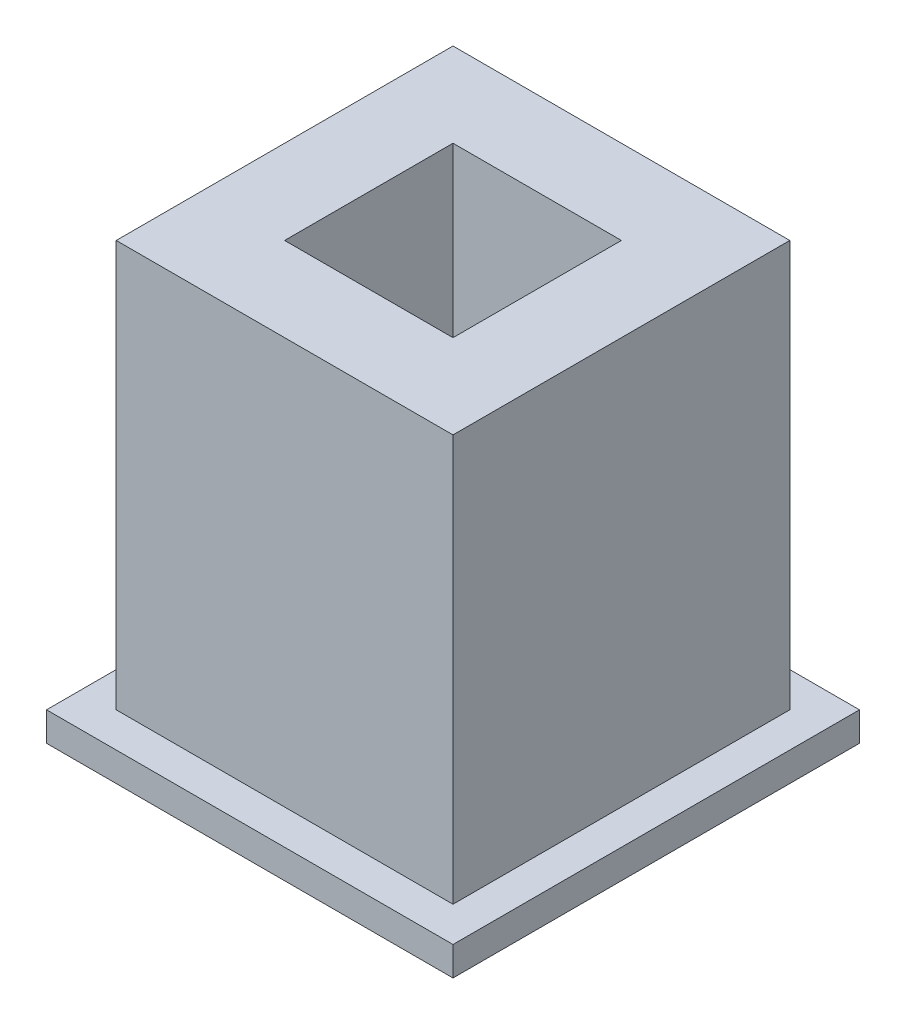
from build123d import *

# Parameters (mm, degrees)
SKETCH1_W           = 5.8
SKETCH1_H           = 5.8
BOSS_EXTRUDE1_DEPTH = 7
SKETCH3_W           = 2.9
SKETCH3_H           = 2.9
CUT_EXTRUDE1_DEPTH  = 3.8
SKETCH4_W           = 7
SKETCH4_H           = 7
BOSS_EXTRUDE2_DEPTH = 1.7
CHAMFER1_SIZE       = 1.2


with BuildPart() as part:
    # Sketch1 → Boss-Extrude1 (new body)
    with BuildSketch(Plane(origin=(0, 0, 0), x_dir=(1, 0, 0), z_dir=(0, 1, 0))):
        with Locations((2.9, 2.9)):
            Rectangle(SKETCH1_W, SKETCH1_H)
    extrude(amount=BOSS_EXTRUDE1_DEPTH)

    # Sketch3 → Cut-Extrude1 (cut)
    with BuildSketch(Plane(origin=(0, 7, 0), x_dir=(1, 0, 0), z_dir=(0, 1, 0))):
        with Locations((2.9, 2.9)):
            Rectangle(SKETCH3_W, SKETCH3_H)
    extrude(amount=-CUT_EXTRUDE1_DEPTH, mode=Mode.SUBTRACT)

    # Sketch4 → Boss-Extrude2 (add)
    with BuildSketch(Plane.XZ):
        with Locations((2.9, -2.9)):
            Rectangle(SKETCH4_W, SKETCH4_H)
    extrude(amount=BOSS_EXTRUDE2_DEPTH)

    # Chamfer1
    chamfer1_edges = [part.edges().sort_by_distance(p)[0] for p in [
        (-0.6, -1.7, -2.9),
        (2.9, -1.7, 0.6),
        (6.4, -1.7, -2.9),
        (2.9, -1.7, -6.4),
    ]]
    chamfer(chamfer1_edges, length=CHAMFER1_SIZE)


solid = part.part
